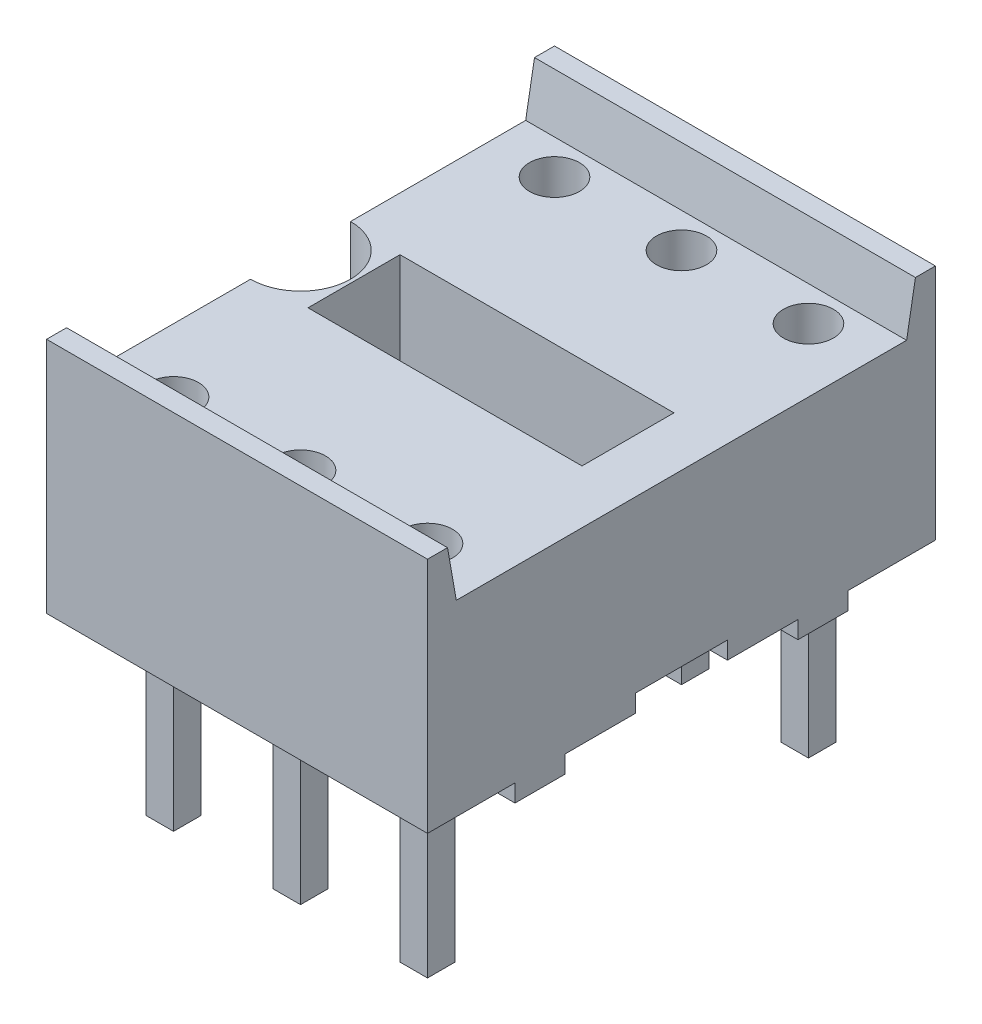
from build123d import *

# Parameters (mm, degrees)
SOCKET_HOUSING_DEPTH  = 7.62
SKETCH3_R             = 0.5
HOLES_DEPTH           = 3
SKETCH4_W             = 0.55
SKETCH4_H             = 0.55
PINS_DEPTH            = 3.5
LPATTERN3_START       = 6.075
LPATTERN3_OUTLINE_W   = 3.5
LPATTERN3_OUTLINE_H   = 0.55
LPATTERN3_DEPTH       = 0.55
LPATTERN3_START_2     = 3.535
LPATTERN3_2_OUTLINE_W = 3.5
LPATTERN3_2_OUTLINE_H = 0.55
LPATTERN3_2_DEPTH     = 0.55
LPATTERN3_START_3     = -3
LPATTERN3_3_OUTLINE_R = 0.5
LPATTERN3_3_DEPTH     = 3
MIRROR2_START         = -3
MIRROR2_OUTLINE_R     = 0.5
MIRROR2_DEPTH         = 3
MIRROR2_START_2       = -7.25
MIRROR2_2_OUTLINE_W   = 0.55
MIRROR2_2_OUTLINE_H   = 0.55
MIRROR2_2_DEPTH       = 3.5
SKETCH5_W             = 5.48
SKETCH5_H             = 1.84
CUT_EXTRUDE3_DEPTH    = 12.6804666


# Read off the part's stored shape, not the designer's step: LPattern3, Mirror2
with BuildPart() as part:
    # Sketch2 → socket_housing (new body)
    with BuildSketch(Plane(origin=(0, 0, 0), x_dir=(0, 0, -1), z_dir=(1, 0, 0))):
        Polygon((-5.08, -3.75), (-3.33, -3.75), (-3.33, -4.1), (-2.33, -4.1), (-2.33, -3.75), (-0.92, -3.75), (-0.92, -3.4), (0, -3.4), (0, 0), (-4.503673019, 0), (-4.68, 1), (-5.08, 1), align=None)
    socket_housing = extrude(amount=SOCKET_HOUSING_DEPTH)

    # Sketch3 → holes (cut)
    with BuildSketch(Plane(origin=(0, 0, 0), x_dir=(1, 0, 0), z_dir=(0, 1, 0))):
        with Locations(Location((1.27, -3.81, 0), (0, 0, 270))):
            Circle(SKETCH3_R)
    extrude(amount=-HOLES_DEPTH, mode=Mode.SUBTRACT)

    # LPattern3 3 outline → LPattern3 3 (cut)
    with BuildSketch(Plane(origin=(0, 0, 0), x_dir=(1, 0, 0), z_dir=(0, 1, 0)).offset(LPATTERN3_START_3)):
        with Locations((6.35, -3.81)):
            Circle(LPATTERN3_3_OUTLINE_R)
        with Locations((3.81, -3.81)):
            Circle(LPATTERN3_3_OUTLINE_R)
    extrude(amount=LPATTERN3_3_DEPTH, mode=Mode.SUBTRACT)

    # Mirror1: socket_housing across plane
    add(socket_housing.mirror(Plane.XY))

    # Mirror2 outline → Mirror2 (cut)
    with BuildSketch(Plane(origin=(0, 0, 0), x_dir=(1, 0, 0), z_dir=(0, 1, 0)).offset(MIRROR2_START)):
        with Locations((6.35, 3.81)):
            Circle(MIRROR2_OUTLINE_R)
        with Locations((3.81, 3.81)):
            Circle(MIRROR2_OUTLINE_R)
        with Locations((1.27, 3.81)):
            Circle(MIRROR2_OUTLINE_R)
    extrude(amount=MIRROR2_DEPTH, mode=Mode.SUBTRACT)

    # Mirror2 2 outline → Mirror2 2 (add)
    with BuildSketch(Plane(origin=(0, 0, 0), x_dir=(1, 0, 0), z_dir=(0, 1, 0)).offset(MIRROR2_START_2)):
        with Locations((6.35, 3.81)):
            Rectangle(MIRROR2_2_OUTLINE_W, MIRROR2_2_OUTLINE_H)
        with Locations((3.81, 3.81)):
            Rectangle(MIRROR2_2_OUTLINE_W, MIRROR2_2_OUTLINE_H)
        with Locations((1.27, 3.81)):
            Rectangle(MIRROR2_2_OUTLINE_W, MIRROR2_2_OUTLINE_H)
    extrude(amount=MIRROR2_2_DEPTH)

    # Sketch5 → Cut-Extrude3 (cut, through all)
    with BuildSketch(Plane(origin=(0, 0, 0), x_dir=(1, 0, 0), z_dir=(0, 1, 0))):
        with BuildLine():
            Line((0, 1), (0, -1))
            ThreePointArc((0, -1), (1, 0), (0, 1))
        make_face()
        with Locations((3.81, 0)):
            Rectangle(SKETCH5_W, SKETCH5_H)
    extrude(amount=-CUT_EXTRUDE3_DEPTH, mode=Mode.SUBTRACT)


with BuildPart() as body_2:
    # Sketch4 → pins (new body)
    with BuildSketch(Plane.XZ.offset(3.75)):
        with Locations((1.27, 3.81)):
            Rectangle(SKETCH4_W, SKETCH4_H)
    extrude(amount=PINS_DEPTH)


with BuildPart() as body_3:
    # LPattern3 outline → LPattern3 (new body)
    with BuildSketch(Plane.YZ.offset(LPATTERN3_START)):
        with Locations((-5.5, 3.81)):
            Rectangle(LPATTERN3_OUTLINE_W, LPATTERN3_OUTLINE_H)
    extrude(amount=LPATTERN3_DEPTH)


with BuildPart() as body_4:
    # LPattern3 2 outline → LPattern3 2 (new body)
    with BuildSketch(Plane.YZ.offset(LPATTERN3_START_2)):
        with Locations((-5.5, 3.81)):
            Rectangle(LPATTERN3_2_OUTLINE_W, LPATTERN3_2_OUTLINE_H)
    extrude(amount=LPATTERN3_2_DEPTH)


solid = Compound([part.part, body_2.part, body_3.part, body_4.part])
